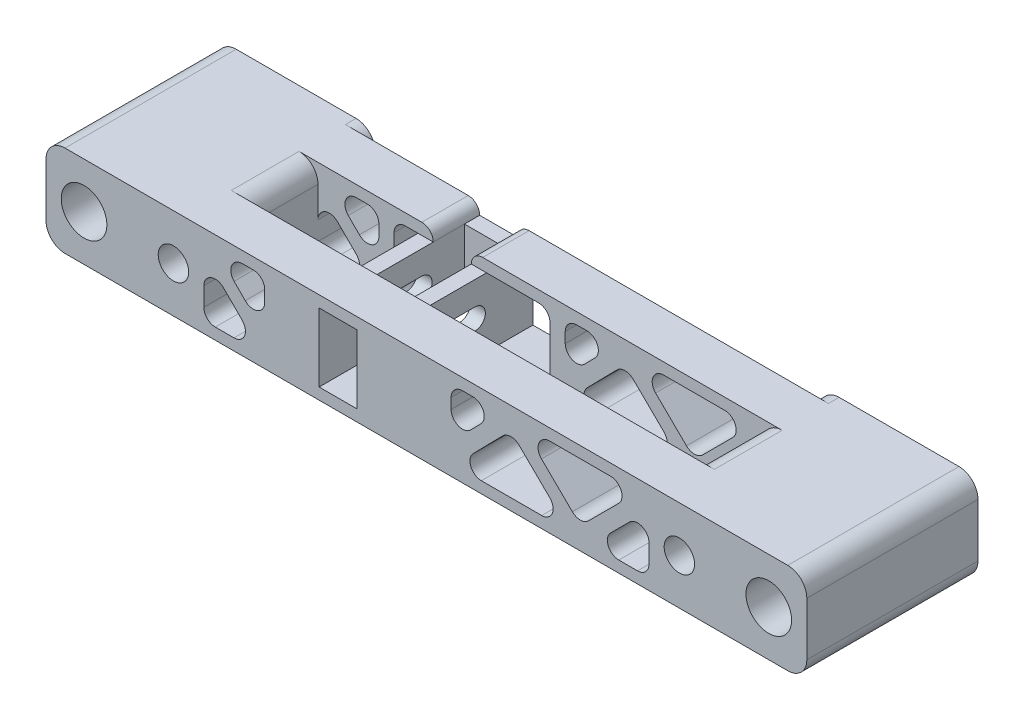
from build123d import *

# Parameters (mm, degrees)
SKETCH1_W           = 100
SKETCH1_H           = 24
SKETCH1_R           = 6
SKETCH1_R_2         = 4
BOSS_EXTRUDE1_DEPTH = 40
SKETCH2_W           = 100
SKETCH2_H           = 24
BOSS_EXTRUDE2_DEPTH = 5
CUT_EXTRUDE1_REACH  = 112.345
SKETCH3_W           = 58.5
SKETCH3_H           = 32.8
SKETCH4_W           = 10
SKETCH4_H           = 18
CUT_EXTRUDE2_DEPTH  = 108.943689023
SKETCH5_W           = 4
SKETCH5_H           = 18
BOSS_EXTRUDE3_DEPTH = 26
SKETCH6_W           = 18
SKETCH6_H           = 18
BOSS_EXTRUDE4_DEPTH = 4
CUT_EXTRUDE3_START  = -18
CUT_EXTRUDE3_DEPTH  = 18
SKETCH8_W           = 76.7
SKETCH8_H           = 12.2
SKETCH8_W_2         = 30.3
BOSS_EXTRUDE5_DEPTH = 3
BOSS_EXTRUDE6_DEPTH = 12.2
FILLET1_R           = 5
FILLET2_R           = 3
CUT_EXTRUDE4_START  = -12.2
CUT_EXTRUDE4_DEPTH  = 12.2


with BuildPart() as part:
    # Sketch1 → Boss-Extrude1 (new body)
    with BuildSketch(Plane.XY):
        with Locations((-50, 12)):
            Rectangle(SKETCH1_W, SKETCH1_H)
        with Locations((-90, 12)):
            Circle(SKETCH1_R, mode=Mode.SUBTRACT)
        with Locations((-66.5, 12)):
            Circle(SKETCH1_R_2, mode=Mode.SUBTRACT)
    boss_extrude1 = extrude(amount=BOSS_EXTRUDE1_DEPTH)

    # Sketch2 → Boss-Extrude2 (add)
    with BuildSketch(Plane(origin=(0, 0, 0), x_dir=(-1, 0, 0), z_dir=(0, 0, -1))):
        with Locations((50, 12)):
            Rectangle(SKETCH2_W, SKETCH2_H)
    boss_extrude2 = extrude(amount=BOSS_EXTRUDE2_DEPTH)

    # Sketch3 → Cut-Extrude1 (cut, up to next)
    with BuildSketch(Plane(origin=(0, 24, 0), x_dir=(1, 0, 0), z_dir=(0, 1, 0)), mode=Mode.PRIVATE) as cut_extrude1_sk1:
        with Locations((-29.25, -11.4)):
            Rectangle(SKETCH3_W, SKETCH3_H)
    cut_extrude1_tool1 = extrude(cut_extrude1_sk1.sketch, amount=-CUT_EXTRUDE1_REACH, mode=Mode.PRIVATE) & part.part
    cut_extrude1 = cut_extrude1_tool1.solids().sort_by_distance((-29.25, 24, 11.4))[0]
    add(cut_extrude1, mode=Mode.SUBTRACT)

    # Mirror2: Boss-Extrude1, Boss-Extrude2, Cut-Extrude1 across Right Plane
    add(boss_extrude1.mirror(Plane(origin=(0, 0, 0), x_dir=(0, 0, -1), z_dir=(1, 0, 0))))
    add(boss_extrude2.mirror(Plane(origin=(0, 0, 0), x_dir=(0, 0, -1), z_dir=(1, 0, 0))))
    add(cut_extrude1.mirror(Plane(origin=(0, 0, 0), x_dir=(0, 0, -1), z_dir=(1, 0, 0))), mode=Mode.SUBTRACT)

    # Sketch4 → Cut-Extrude2 (cut, through all)
    with BuildSketch(Plane(origin=(0, 0, 27.8), x_dir=(-1, 0, 0), z_dir=(0, 0, -1))):
        with Locations((23.2, 12)):
            Rectangle(SKETCH4_W, SKETCH4_H)
    extrude(amount=-CUT_EXTRUDE2_DEPTH, mode=Mode.SUBTRACT)

    # Sketch5 → Boss-Extrude3 (add)
    with BuildSketch(Plane(origin=(0, 0, 27.8), x_dir=(-1, 0, 0), z_dir=(0, 0, -1))):
        with Locations((30.2, 12)):
            Rectangle(SKETCH5_W, SKETCH5_H)
        with Locations((16.2, 12)):
            Rectangle(SKETCH5_W, SKETCH5_H)
    extrude(amount=BOSS_EXTRUDE3_DEPTH)

    # Sketch6 → Boss-Extrude4 (add)
    with BuildSketch(Plane(origin=(0, 0, 1.8), x_dir=(-1, 0, 0), z_dir=(0, 0, -1))):
        with Locations((23.2, 12)):
            Rectangle(SKETCH6_W, SKETCH6_H)
    extrude(amount=BOSS_EXTRUDE4_DEPTH)

    # Sketch7 → Cut-Extrude3 (cut)
    with BuildSketch(Plane(origin=(-14.2, 0, 0), x_dir=(0, 0, -1), z_dir=(1, 0, 0)).offset(CUT_EXTRUDE3_START)):
        with BuildLine():
            Line((-22.05, 14.75), (-13.05, 14.75))
            ThreePointArc((-13.05, 14.75), (-10.3, 12), (-13.05, 9.25))
            Line((-13.05, 9.25), (-22.05, 9.25))
            ThreePointArc((-22.05, 9.25), (-24.8, 12), (-22.05, 14.75))
        make_face()
    extrude(amount=CUT_EXTRUDE3_DEPTH, mode=Mode.SUBTRACT)

    # Sketch8 → Boss-Extrude5 (add)
    with BuildSketch(Plane(origin=(0, 21, 0), x_dir=(1, 0, 0), z_dir=(0, 1, 0))):
        with Locations((20.15, -3.9)):
            Rectangle(SKETCH8_W, SKETCH8_H)
        with Locations((-43.35, -3.9)):
            Rectangle(SKETCH8_W_2, SKETCH8_H)
    boss_extrude5 = extrude(amount=BOSS_EXTRUDE5_DEPTH)

    # Mirror4: Boss-Extrude5 across plane
    add(boss_extrude5.mirror(Plane.ZX.offset(12)))

    # Sketch9 → Boss-Extrude6 (add)
    with BuildSketch(Plane(origin=(0, 0, -2.2), x_dir=(-1, 0, 0), z_dir=(0, 0, -1))):
        Polygon((-58.5, 18.171572875), (-43.328427125, 3), (-37.643941895, 3), (-22.177232561, 18.171703978), (-7.294907133, 3), (-2.493324251, 3), (-2.493324251, 21), (-6.493324251, 21), (-6.493324251, 7.894946994), (-19.348417117, 21), (-25.006058105, 21), (-40.486448643, 5.814875767), (-55.671572875, 21), (-58.5, 21), align=None)
        Polygon((55.671572875, 21), (42.5, 7.828427125), (42.5, 21), (38.5, 21), (38.5, 3), (43.328427125, 3), (58.5, 18.171572875), (58.5, 21), align=None)
    extrude(amount=-BOSS_EXTRUDE6_DEPTH)

    # Fillet1
    # the kernel refuses this fillet: 5 mm, written as the material it adds along each edge
    # the kernel refuses this fillet: 5 mm, written as the material it takes off along each edge
    with BuildSketch(Plane(origin=(58.5, 24, -2.5), x_dir=(1, 0, 0), z_dir=(0, 0, 1))) as fillet1_2_piece_1_section:
        with BuildLine():
            CenterArc((FILLET1_R, -FILLET1_R), FILLET1_R, 90, 90)
            Line((0, -FILLET1_R), (0, 0))
            Line((0, 0), (FILLET1_R, 0))
        make_face()
    fillet1_2_piece_1 = extrude(amount=42.8, mode=Mode.PRIVATE)
    fillet1_2_piece_1 = split(fillet1_2_piece_1, bisect_by=Plane(origin=(59.616839695, 22.883160305, -2.2), z_dir=(0, 0, -1)), keep=Keep.TOP, mode=Mode.PRIVATE)
    add(fillet1_2_piece_1, mode=Mode.SUBTRACT)
    with BuildSketch(Plane(origin=(58.5, 24, 10), x_dir=(1, 0, 0), z_dir=(0, 0, 1)), Plane(origin=(-58.5, 0, 10), x_dir=(-1, 0, 0), z_dir=(0, 0, 1))) as fillet1_2_piece_2:
        with BuildLine():
            CenterArc((FILLET1_R, -FILLET1_R), FILLET1_R, 90, 90)
            Line((0, -FILLET1_R), (0, 0))
            Line((0, 0), (FILLET1_R, 0))
        make_face()
    extrude(amount=17.8, mode=Mode.SUBTRACT)
    with BuildSketch(Plane(origin=(-58.5, 24, -2.5), x_dir=(-1, 0, 0), z_dir=(0, 0, 1))) as fillet1_2_piece_3_section:
        with BuildLine():
            CenterArc((FILLET1_R, FILLET1_R), FILLET1_R, 180, 90)
            Line((0, FILLET1_R), (0, 0))
            Line((0, 0), (FILLET1_R, 0))
        make_face()
    fillet1_2_piece_3 = extrude(amount=42.8, mode=Mode.PRIVATE)
    fillet1_2_piece_3 = split(fillet1_2_piece_3, bisect_by=Plane(origin=(-59.616839695, 22.883160305, -2.2), z_dir=(0, 0, -1)), keep=Keep.TOP, mode=Mode.PRIVATE)
    add(fillet1_2_piece_3, mode=Mode.SUBTRACT)
    with BuildSketch(Plane(origin=(-58.5, 24, 10), x_dir=(-1, 0, 0), z_dir=(0, 0, 1)), Plane(origin=(58.5, 0, 10), x_dir=(1, 0, 0), z_dir=(0, 0, 1))) as fillet1_2_piece_4:
        with BuildLine():
            CenterArc((FILLET1_R, FILLET1_R), FILLET1_R, 180, 90)
            Line((0, FILLET1_R), (0, 0))
            Line((0, 0), (FILLET1_R, 0))
        make_face()
    extrude(amount=17.8, mode=Mode.SUBTRACT)
    with BuildSketch(Plane(origin=(58.5, 0, -17.5), x_dir=(1, 0, 0), z_dir=(0, 0, 1)), Plane(origin=(-58.5, 24, -17.5), x_dir=(-1, 0, 0), z_dir=(0, 0, 1))) as fillet1_2_piece_5:
        with BuildLine():
            CenterArc((FILLET1_R, FILLET1_R), FILLET1_R, 180, 90)
            Line((0, FILLET1_R), (0, 0))
            Line((0, 0), (FILLET1_R, 0))
        make_face()
    extrude(amount=15.3, mode=Mode.SUBTRACT)
    with BuildSketch(Plane(origin=(58.5, 0, -17.5), x_dir=(1, 0, 0), z_dir=(0, 0, 1))) as fillet1_2_piece_6_section:
        with BuildLine():
            CenterArc((FILLET1_R, FILLET1_R), FILLET1_R, 180, 90)
            Line((0, FILLET1_R), (0, 0))
            Line((0, 0), (FILLET1_R, 0))
        make_face()
    fillet1_2_piece_6 = extrude(amount=27.8, mode=Mode.PRIVATE)
    fillet1_2_piece_6 = split(fillet1_2_piece_6, bisect_by=Plane(origin=(58.624277222, 3, 3.9), z_dir=(0, 1, 0)), keep=Keep.TOP, mode=Mode.PRIVATE)
    add(fillet1_2_piece_6, mode=Mode.SUBTRACT)
    with BuildSketch(Plane(origin=(58.5, 0, -17.5), x_dir=(1, 0, 0), z_dir=(0, 0, 1))) as fillet1_2_piece_7_section:
        with BuildLine():
            CenterArc((FILLET1_R, FILLET1_R), FILLET1_R, 180, 90)
            Line((0, FILLET1_R), (0, 0))
            Line((0, 0), (FILLET1_R, 0))
        make_face()
    fillet1_2_piece_7 = extrude(amount=27.8, mode=Mode.PRIVATE)
    fillet1_2_piece_7 = split(fillet1_2_piece_7, bisect_by=Plane(origin=(59.670149221, 0.989071886, 10), z_dir=(0, 0, 1)), keep=Keep.TOP, mode=Mode.PRIVATE)
    add(fillet1_2_piece_7, mode=Mode.SUBTRACT)
    with BuildSketch(Plane(origin=(-58.5, 0, -17.5), x_dir=(-1, 0, 0), z_dir=(0, 0, 1)), Plane(origin=(58.5, 24, -17.5), x_dir=(1, 0, 0), z_dir=(0, 0, 1))) as fillet1_2_piece_8:
        with BuildLine():
            CenterArc((FILLET1_R, -FILLET1_R), FILLET1_R, 90, 90)
            Line((0, -FILLET1_R), (0, 0))
            Line((0, 0), (FILLET1_R, 0))
        make_face()
    extrude(amount=15.3, mode=Mode.SUBTRACT)
    with BuildSketch(Plane(origin=(-58.5, 0, -17.5), x_dir=(-1, 0, 0), z_dir=(0, 0, 1))) as fillet1_2_piece_9_section:
        with BuildLine():
            CenterArc((FILLET1_R, -FILLET1_R), FILLET1_R, 90, 90)
            Line((0, -FILLET1_R), (0, 0))
            Line((0, 0), (FILLET1_R, 0))
        make_face()
    fillet1_2_piece_9 = extrude(amount=27.8, mode=Mode.PRIVATE)
    fillet1_2_piece_9 = split(fillet1_2_piece_9, bisect_by=Plane(origin=(-58.624277222, 3, 3.9), z_dir=(0, 1, 0)), keep=Keep.TOP, mode=Mode.PRIVATE)
    add(fillet1_2_piece_9, mode=Mode.SUBTRACT)
    with BuildSketch(Plane(origin=(-58.5, 0, -17.5), x_dir=(-1, 0, 0), z_dir=(0, 0, 1))) as fillet1_2_piece_10_section:
        with BuildLine():
            CenterArc((FILLET1_R, -FILLET1_R), FILLET1_R, 90, 90)
            Line((0, -FILLET1_R), (0, 0))
            Line((0, 0), (FILLET1_R, 0))
        make_face()
    fillet1_2_piece_10 = extrude(amount=27.8, mode=Mode.PRIVATE)
    fillet1_2_piece_10 = split(fillet1_2_piece_10, bisect_by=Plane(origin=(-59.670149221, 0.989071886, 10), z_dir=(0, 0, 1)), keep=Keep.TOP, mode=Mode.PRIVATE)
    add(fillet1_2_piece_10, mode=Mode.SUBTRACT)
    with BuildSketch(Plane(origin=(-58.5, 24, -17.5), x_dir=(-1, 0, 0), z_dir=(0, 0, 1))) as fillet1_2_piece_11_section:
        with BuildLine():
            CenterArc((FILLET1_R, FILLET1_R), FILLET1_R, 180, 90)
            Line((0, FILLET1_R), (0, 0))
            Line((0, 0), (FILLET1_R, 0))
        make_face()
    fillet1_2_piece_11 = extrude(amount=27.8, mode=Mode.PRIVATE)
    fillet1_2_piece_11 = split(fillet1_2_piece_11, bisect_by=Plane(origin=(-59.616839695, 22.883160305, 10), z_dir=(0, 0, 1)), keep=Keep.TOP, mode=Mode.PRIVATE)
    add(fillet1_2_piece_11, mode=Mode.SUBTRACT)
    with BuildSketch(Plane(origin=(-58.5, 0, -2.5), x_dir=(-1, 0, 0), z_dir=(0, 0, 1))) as fillet1_2_piece_12_section:
        with BuildLine():
            CenterArc((FILLET1_R, -FILLET1_R), FILLET1_R, 90, 90)
            Line((0, -FILLET1_R), (0, 0))
            Line((0, 0), (FILLET1_R, 0))
        make_face()
    fillet1_2_piece_12 = extrude(amount=42.8, mode=Mode.PRIVATE)
    fillet1_2_piece_12 = split(fillet1_2_piece_12, bisect_by=Plane(origin=(-59.670149221, 0.989071886, -2.2), z_dir=(0, 0, -1)), keep=Keep.TOP, mode=Mode.PRIVATE)
    add(fillet1_2_piece_12, mode=Mode.SUBTRACT)
    with BuildSketch(Plane(origin=(-58.5, 0, -2.5), x_dir=(-1, 0, 0), z_dir=(0, 0, 1))) as fillet1_2_piece_13_section:
        with BuildLine():
            CenterArc((FILLET1_R, -FILLET1_R), FILLET1_R, 90, 90)
            Line((0, -FILLET1_R), (0, 0))
            Line((0, 0), (FILLET1_R, 0))
        make_face()
    fillet1_2_piece_13 = extrude(amount=30.3, mode=Mode.PRIVATE)
    fillet1_2_piece_13 = split(fillet1_2_piece_13, bisect_by=Plane(origin=(-58.624277222, 3, 3.9), z_dir=(0, 1, 0)), keep=Keep.TOP, mode=Mode.PRIVATE)
    add(fillet1_2_piece_13, mode=Mode.SUBTRACT)
    with BuildSketch(Plane(origin=(100, 0, -17.5), x_dir=(-1, 0, 0), z_dir=(0, 0, 1)), Plane(origin=(-100, 0, 52.5), x_dir=(1, 0, 0), z_dir=(0, 0, -1))) as fillet1_2_piece_14:
        with BuildLine():
            CenterArc((FILLET1_R, -FILLET1_R), FILLET1_R, 90, 90)
            Line((0, -FILLET1_R), (0, 0))
            Line((0, 0), (FILLET1_R, 0))
        make_face()
    extrude(amount=70, mode=Mode.SUBTRACT)
    with BuildSketch(Plane(origin=(100, 24, -17.5), x_dir=(-1, 0, 0), z_dir=(0, 0, 1)), Plane(origin=(-100, 24, 52.5), x_dir=(1, 0, 0), z_dir=(0, 0, -1))) as fillet1_2_piece_15:
        with BuildLine():
            CenterArc((FILLET1_R, FILLET1_R), FILLET1_R, 180, 90)
            Line((0, FILLET1_R), (0, 0))
            Line((0, 0), (FILLET1_R, 0))
        make_face()
    extrude(amount=70, mode=Mode.SUBTRACT)
    with BuildSketch(Plane(origin=(58.5, 0, -2.5), x_dir=(1, 0, 0), z_dir=(0, 0, 1))) as fillet1_2_piece_16_section:
        with BuildLine():
            CenterArc((FILLET1_R, FILLET1_R), FILLET1_R, 180, 90)
            Line((0, FILLET1_R), (0, 0))
            Line((0, 0), (FILLET1_R, 0))
        make_face()
    fillet1_2_piece_16 = extrude(amount=42.8, mode=Mode.PRIVATE)
    fillet1_2_piece_16 = split(fillet1_2_piece_16, bisect_by=Plane(origin=(59.670149221, 0.989071886, -2.2), z_dir=(0, 0, -1)), keep=Keep.TOP, mode=Mode.PRIVATE)
    add(fillet1_2_piece_16, mode=Mode.SUBTRACT)
    with BuildSketch(Plane(origin=(58.5, 0, -2.5), x_dir=(1, 0, 0), z_dir=(0, 0, 1))) as fillet1_2_piece_17_section:
        with BuildLine():
            CenterArc((FILLET1_R, FILLET1_R), FILLET1_R, 180, 90)
            Line((0, FILLET1_R), (0, 0))
            Line((0, 0), (FILLET1_R, 0))
        make_face()
    fillet1_2_piece_17 = extrude(amount=30.3, mode=Mode.PRIVATE)
    fillet1_2_piece_17 = split(fillet1_2_piece_17, bisect_by=Plane(origin=(58.624277222, 3, 3.9), z_dir=(0, 1, 0)), keep=Keep.TOP, mode=Mode.PRIVATE)
    add(fillet1_2_piece_17, mode=Mode.SUBTRACT)
    with BuildSketch(Plane(origin=(58.5, 24, -17.5), x_dir=(1, 0, 0), z_dir=(0, 0, 1))) as fillet1_2_piece_18_section:
        with BuildLine():
            CenterArc((FILLET1_R, -FILLET1_R), FILLET1_R, 90, 90)
            Line((0, -FILLET1_R), (0, 0))
            Line((0, 0), (FILLET1_R, 0))
        make_face()
    fillet1_2_piece_18 = extrude(amount=27.8, mode=Mode.PRIVATE)
    fillet1_2_piece_18 = split(fillet1_2_piece_18, bisect_by=Plane(origin=(59.616839695, 22.883160305, 10), z_dir=(0, 0, 1)), keep=Keep.TOP, mode=Mode.PRIVATE)
    add(fillet1_2_piece_18, mode=Mode.SUBTRACT)

    # Fillet2
    # the kernel refuses this fillet: 3 mm, written as the material it adds along each edge
    with BuildSketch(Plane(origin=(-32.2, 3, 27.8), x_dir=(0, -1, 0), z_dir=(1, 0, 0)), Plane(origin=(-28.2, 21, 27.8), x_dir=(0, 1, 0), z_dir=(-1, 0, 0)), Plane(origin=(-18.2, 21, 27.8), x_dir=(0, 0, -1), z_dir=(1, 0, 0)), Plane(origin=(-14.2, 3, 27.8), x_dir=(0, 0, -1), z_dir=(-1, 0, 0))) as fillet2_piece_1:
        with BuildLine():
            CenterArc((FILLET2_R, FILLET2_R), FILLET2_R, 180, 90)
            Line((0, FILLET2_R), (0, 0))
            Line((0, 0), (FILLET2_R, 0))
        make_face()
    extrude(amount=4)
    with BuildSketch(Plane(origin=(55.671572875, 21, -2.2), x_dir=(-1, 0, 0), z_dir=(0, 0, 1)), Plane(origin=(-58.5, 18.171572875, -2.2), x_dir=(0, -1, 0), z_dir=(0, 0, 1)), Plane(origin=(-43.328427125, 3, -2.2), x_dir=(-0.7071067811865437, 0.7071067811865515, 0), z_dir=(0, 0, 1)), Plane(origin=(-55.671572875, 21, -2.2), x_dir=(0.7071067811865441, -0.7071067811865509, 0), z_dir=(0, 0, 1))) as fillet2_piece_2:
        with BuildLine():
            CenterArc((FILLET2_R * 2.41421356237, FILLET2_R), FILLET2_R, 135, 135)
            Line((FILLET2_R * 1.70710678119, FILLET2_R * 1.70710678119), (0, 0))
            Line((0, 0), (FILLET2_R * 2.41421356237, 0))
        make_face()
    extrude(amount=12.2)
    with BuildSketch(Plane(origin=(40.486448643, 5.814875767, -2.2), x_dir=(0.7071067811865565, 0.7071067811865386, 0), z_dir=(0, 0, 1))) as fillet2_piece_3:
        with BuildLine():
            CenterArc((FILLET2_R * 0.990417743269, FILLET2_R), FILLET2_R, 180.55166171, 89.44833829)
            Line((-FILLET2_R * 0.00953590488174, FILLET2_R * 0.990371835575), (0, 0))
            Line((0, 0), (FILLET2_R * 0.990417743269, 0))
        make_face()
    extrude(amount=12.2)
    with BuildSketch(Plane(origin=(25.006058105, 21, -2.2), x_dir=(1, 0, 0), z_dir=(0, 0, 1))) as fillet2_piece_4:
        with BuildLine():
            CenterArc((FILLET2_R * 2.44747349713, -FILLET2_R), FILLET2_R, 90, 135.55166171)
            Line((FILLET2_R * 1.747207632, -FILLET2_R * 1.71388214583), (0, 0))
            Line((0, 0), (FILLET2_R * 2.44747349713, 0))
        make_face()
    extrude(amount=12.2)
    with BuildSketch(Plane(origin=(19.348417117, 21, -2.2), x_dir=(-1, 0, 0), z_dir=(0, 0, 1))) as fillet2_piece_5:
        with BuildLine():
            CenterArc((FILLET2_R * 2.38171787184, FILLET2_R), FILLET2_R, 135.55166171, 134.44833829)
            Line((FILLET2_R * 1.66783572601, FILLET2_R * 1.70026586512), (0, 0))
            Line((0, 0), (FILLET2_R * 2.38171787184, 0))
        make_face()
    extrude(amount=12.2)
    with BuildSketch(Plane(origin=(6.493324251, 7.894946994, -2.2), x_dir=(0.7002658651241891, 0.7138821458349208, 0), z_dir=(0, 0, 1)), Plane(origin=(37.643941895, 3, -2.2), x_dir=(-0.713882145834921, 0.7002658651241889, 0), z_dir=(0, 0, 1))) as fillet2_piece_6:
        with BuildLine():
            CenterArc((FILLET2_R * 2.44747349713, FILLET2_R), FILLET2_R, 134.44833829, 135.55166171)
            Line((FILLET2_R * 1.747207632, FILLET2_R * 1.71388214583), (0, 0))
            Line((0, 0), (FILLET2_R * 2.44747349713, 0))
        make_face()
    extrude(amount=12.2)
    with BuildSketch(Plane(origin=(6.493324251, 21, -2.2), x_dir=(1, 0, 0), z_dir=(0, 0, 1)), Plane(origin=(2.493324251, 21, -2.2), x_dir=(0, -1, 0), z_dir=(0, 0, 1)), Plane(origin=(2.493324251, 3, -2.2), x_dir=(-1, 0, 0), z_dir=(0, 0, 1))) as fillet2_piece_7:
        with BuildLine():
            CenterArc((FILLET2_R, -FILLET2_R), FILLET2_R, 90, 90)
            Line((0, -FILLET2_R), (0, 0))
            Line((0, 0), (FILLET2_R, 0))
        make_face()
    extrude(amount=12.2)
    with BuildSketch(Plane(origin=(7.294907133, 3, -2.2), x_dir=(0.7002658651241888, 0.713882145834921, 0), z_dir=(0, 0, 1))) as fillet2_piece_8:
        with BuildLine():
            CenterArc((FILLET2_R * 2.38171787184, -FILLET2_R), FILLET2_R, 90, 134.44833829)
            Line((FILLET2_R * 1.66783572601, -FILLET2_R * 1.70026586512), (0, 0))
            Line((0, 0), (FILLET2_R * 2.38171787184, 0))
        make_face()
    extrude(amount=12.2)
    with BuildSketch(Plane(origin=(22.177232561, 18.171703978, -2.2), x_dir=(-0.700265865124189, -0.7138821458349208, 0), z_dir=(0, 0, 1)), Plane(origin=(-38.5, 3, -2.2), x_dir=(1, 0, 0), z_dir=(0, 0, 1)), Plane(origin=(-38.5, 21, -2.2), x_dir=(0, -1, 0), z_dir=(0, 0, 1)), Plane(origin=(-42.5, 21, -2.2), x_dir=(-1, 0, 0), z_dir=(0, 0, 1))) as fillet2_piece_9:
        with BuildLine():
            CenterArc((FILLET2_R, FILLET2_R), FILLET2_R, 180, 90)
            Line((0, FILLET2_R), (0, 0))
            Line((0, 0), (FILLET2_R, 0))
        make_face()
    extrude(amount=12.2)
    with BuildSketch(Plane(origin=(43.328427125, 3, -2.2), x_dir=(0.707106781186556, 0.7071067811865389, 0), z_dir=(0, 0, 1)), Plane(origin=(58.5, 18.171572875, -2.2), x_dir=(0, -1, 0), z_dir=(0, 0, 1)), Plane(origin=(-42.5, 7.828427125, -2.2), x_dir=(-0.707106781186544, 0.707106781186551, 0), z_dir=(0, 0, 1))) as fillet2_piece_10:
        with BuildLine():
            CenterArc((FILLET2_R * 2.41421356237, -FILLET2_R), FILLET2_R, 90, 135)
            Line((FILLET2_R * 1.70710678119, -FILLET2_R * 1.70710678119), (0, 0))
            Line((0, 0), (FILLET2_R * 2.41421356237, 0))
        make_face()
    extrude(amount=12.2)
    with BuildSketch(Plane(origin=(58.917424305, 3, 10), x_dir=(-1, 0, 0), z_dir=(0, 0, -1))) as fillet2_piece_11:
        with BuildLine():
            CenterArc((3.417424305, 3), FILLET2_R, 180, 90)
            Line((0.417424305, 3), (0.117424305, 3))
            ThreePointArc((0.117424305, 3), (0.117424305, 2), (-0.274954542, 0.12))
            Line((-0.274954542, 0.12), (0, -0.3))
            Line((0, -0.3), (3.417424305, -0.3))
            Line((3.417424305, -0.3), (3.417424305, 0))
        make_face()
    extrude(amount=12.2)
    with BuildSketch(Plane(origin=(-58.917424305, 3, 10), x_dir=(1, 0, 0), z_dir=(0, 0, -1))) as fillet2_piece_12:
        with BuildLine():
            CenterArc((3.417424305, -3), FILLET2_R, 90, 90)
            Line((0.417424305, -3), (0.117424305, -3))
            ThreePointArc((0.117424305, -3), (0.117424305, -2), (-0.274954542, -0.12))
            Line((-0.274954542, -0.12), (0, 0.3))
            Line((0, 0.3), (3.417424305, 0.3))
            Line((3.417424305, 0.3), (3.417424305, 0))
        make_face()
    extrude(amount=12.2)
    # the kernel refuses this fillet: 3 mm, written as the material it takes off along each edge
    with BuildSketch(Plane(origin=(-18.2, 24, 17.5), x_dir=(1, 0, 0), z_dir=(0, 0, -1)), Plane(origin=(-28.2, 0, 17.5), x_dir=(-1, 0, 0), z_dir=(0, 0, -1))) as fillet2_2_piece_1:
        with BuildLine():
            CenterArc((FILLET2_R, FILLET2_R), FILLET2_R, 180, 90)
            Line((0, FILLET2_R), (0, 0))
            Line((0, 0), (FILLET2_R, 0))
        make_face()
    extrude(amount=27.2, mode=Mode.SUBTRACT)
    with BuildSketch(Plane(origin=(-28.2, 24, 17.5), x_dir=(-1, 0, 0), z_dir=(0, 0, -1)), Plane(origin=(-18.2, 0, 17.5), x_dir=(1, 0, 0), z_dir=(0, 0, -1))) as fillet2_2_piece_2:
        with BuildLine():
            CenterArc((FILLET2_R, -FILLET2_R), FILLET2_R, 90, 90)
            Line((0, -FILLET2_R), (0, 0))
            Line((0, 0), (FILLET2_R, 0))
        make_face()
    extrude(amount=27.2, mode=Mode.SUBTRACT)

    # Sketch10 → Cut-Extrude4 (cut)
    with BuildSketch(Plane.XY.offset(40).offset(CUT_EXTRUDE4_START)):
        with BuildLine():
            Line((-55.5, 3), (-50.571067812, 3))
            ThreePointArc((-50.571067812, 3), (-47.799429214, 4.851949703), (-48.449747468, 8.121320344))
            Line((-48.449747468, 8.121320344), (-53.378679656, 13.050252532))
            ThreePointArc((-53.378679656, 13.050252532), (-56.648050297, 13.700570786), (-58.5, 10.928932188))
            Line((-58.5, 10.928932188), (-58.5, 6))
            ThreePointArc((-58.5, 6), (-57.621320344, 3.878679656), (-55.5, 3))
        make_face()
        with BuildLine():
            Line((-50.550252532, 15.878679656), (-47.621320344, 12.949747468))
            ThreePointArc((-47.621320344, 12.949747468), (-44.351949703, 12.299429214), (-42.5, 15.071067812))
            Line((-42.5, 15.071067812), (-42.5, 18))
            ThreePointArc((-42.5, 18), (-43.378679656, 20.121320344), (-45.5, 21))
            Line((-45.5, 21), (-48.428932188, 21))
            ThreePointArc((-48.428932188, 21), (-51.200570786, 19.148050297), (-50.550252532, 15.878679656))
        make_face()
        with BuildLine():
            Line((6.493324251, 18), (6.493324251, 15.237367486))
            ThreePointArc((6.493324251, 15.237367486), (8.358630308, 12.460234133), (11.634970688, 13.13656989))
            Line((11.634970688, 13.13656989), (14.344909939, 15.899202405))
            ThreePointArc((14.344909939, 15.899202405), (14.969343109, 19.161380044), (12.203263502, 21))
            Line((12.203263502, 21), (9.493324251, 21))
            ThreePointArc((9.493324251, 21), (7.372003907, 20.121320344), (6.493324251, 18))
        make_face()
        with BuildLine():
            Line((14.440060749, 3), (30.301521403, 3))
            ThreePointArc((30.301521403, 3), (33.078654756, 4.865306057), (32.402318999, 8.141646438))
            Line((32.402318999, 8.141646438), (24.318878999, 16.070906383))
            ThreePointArc((24.318878999, 16.070906383), (22.18919691, 16.92912089), (20.076434966, 16.030057541))
            Line((20.076434966, 16.030057541), (12.298414311, 8.100797595))
            ThreePointArc((12.298414311, 8.100797595), (11.673981142, 4.838619956), (14.440060749, 3))
        make_face()
        with BuildLine():
            Line((50.571067812, 3), (55.5, 3))
            ThreePointArc((55.5, 3), (57.621320344, 3.878679656), (58.5, 6))
            Line((58.5, 6), (58.5, 10.928932188))
            ThreePointArc((58.5, 10.928932188), (56.648050297, 13.700570786), (53.378679656, 13.050252532))
            Line((53.378679656, 13.050252532), (48.449747468, 8.121320344))
            ThreePointArc((48.449747468, 8.121320344), (47.799429214, 4.851949703), (50.571067812, 3))
        make_face()
        with BuildLine():
            Line((32.348478597, 21), (48.428932188, 21))
            ThreePointArc((48.428932188, 21), (51.200570786, 19.148050297), (50.550252532, 15.878679656))
            Line((50.550252532, 15.878679656), (42.58744195, 7.915869075))
            ThreePointArc((42.58744195, 7.915869075), (40.48056402, 7.037224182), (38.365324011, 7.895542981))
            Line((38.365324011, 7.895542981), (30.247681001, 15.858353562))
            ThreePointArc((30.247681001, 15.858353562), (29.571345244, 19.134693943), (32.348478597, 21))
        make_face()
    extrude(amount=CUT_EXTRUDE4_DEPTH, mode=Mode.SUBTRACT)


solid = part.part
